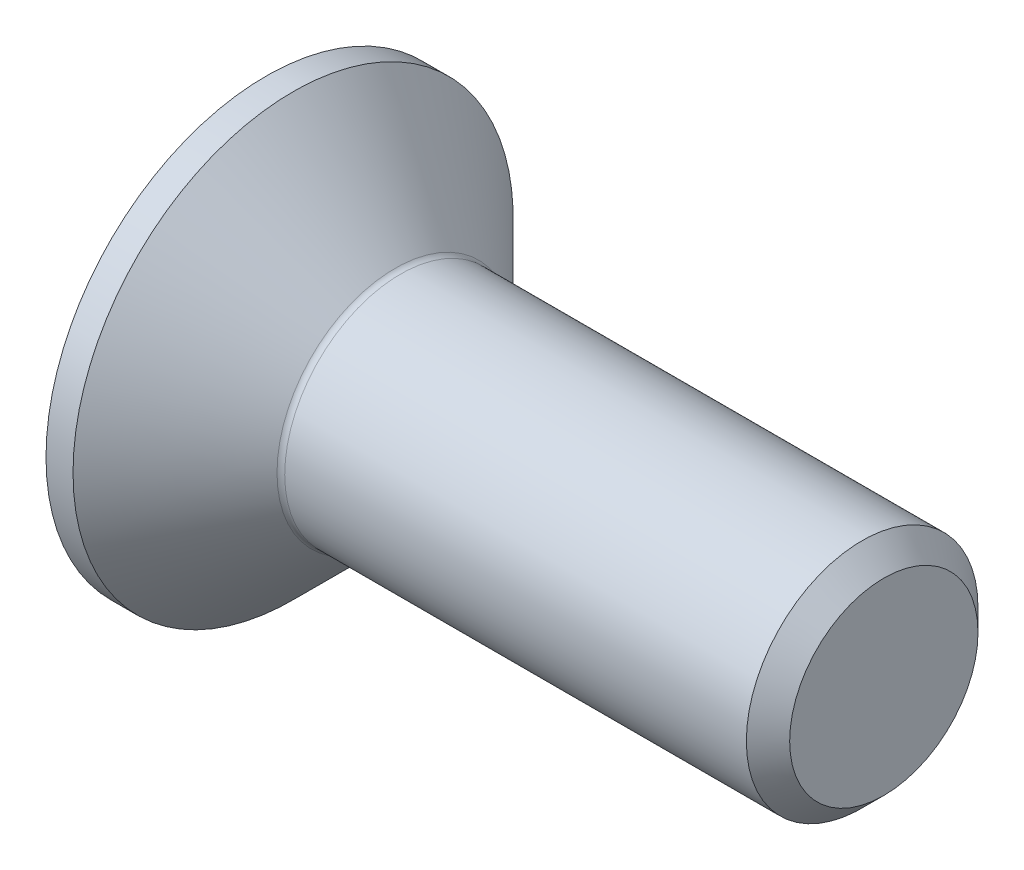
from build123d import *

# Parameters (mm, degrees)
FILLET1_R   = 0.1
HEX_2_DEPTH = 1.2


with BuildPart() as part:
    # BodySke → BaseBody (revolve)
    with BuildSketch(Plane.XY):
        Polygon((0, 0), (0, 2.85), (0.35, 2.85), (1.7, 1.5), (7.7195, 1.5), (8, 1.2195), (8, 0), align=None)
    revolve(axis=Axis((0, 0, 0), (1, 0, 0)))

    # Fillet1
    fillet1_edges = [part.edges().sort_by_distance(p)[0] for p in [
        (1.7, -1.5, 0),
    ]]
    fillet(fillet1_edges, radius=FILLET1_R)

    # Sketch2 → PreBroach (revolve, cut)
    with BuildSketch(Plane.XY):
        Polygon((0, 1.01), (1.2, 1.01), (1.783123772, 0), (0, 0), align=None)
    revolve(axis=Axis((0, 0, 0), (1, 0, 0)), mode=Mode.SUBTRACT)

    # Sketch3 → Hex 2 (cut)
    with BuildSketch(Plane.ZY):
        Polygon((-1.01, -0.583123772), (-1.01, 0.583123772), (0, 1.166247544), (1.01, 0.583123772), (1.01, -0.583123772), (0, -1.166247544), align=None)
    extrude(amount=-HEX_2_DEPTH, mode=Mode.SUBTRACT)


solid = part.part
